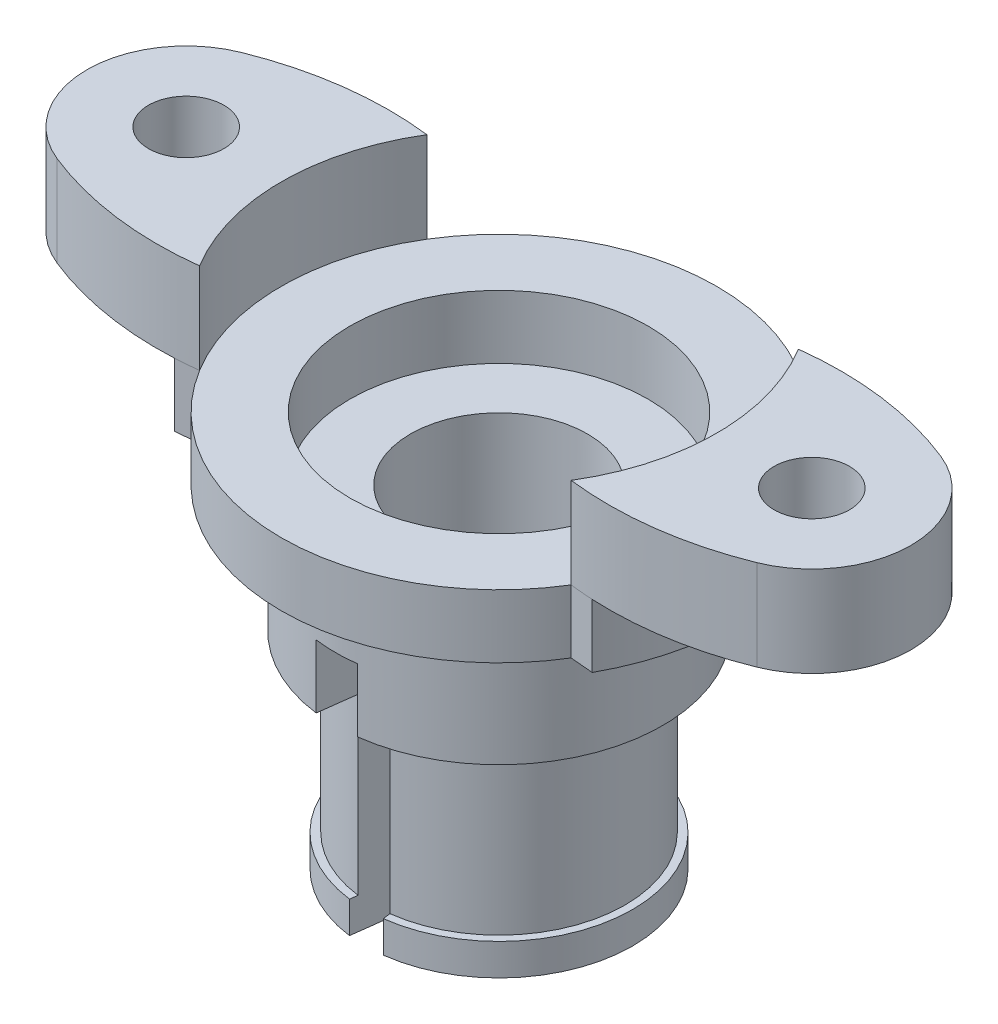
from build123d import *

# Parameters (mm, degrees)
SKETCH1_R             = 23.55
SKETCH1_R_2           = 14
BOSS_EXTRUDE4_DEPTH   = 10
SKETCH6_R             = 34.4
SKETCH6_R_2           = 23.55
BOSS_EXTRUDE5_DEPTH   = 10
SKETCH8_R             = 5.9563
BOSS_EXTRUDE7_DEPTH   = 14.3
BOSS_EXTRUDE7_2_DEPTH = 14.3
BOSS_EXTRUDE8_DEPTH   = 10
SKETCH10_R            = 25.832365573
SKETCH10_R_2          = 23.55
BOSS_EXTRUDE9_DEPTH   = 10
BOSS_EXTRUDE10_START  = 10
BOSS_EXTRUDE10_DEPTH  = 10
BOSS_EXTRUDE11_DEPTH  = 27.5
FILLET4_R             = 10
FILLET5_R             = 10
BOSS_EXTRUDE13_DEPTH  = 5


with BuildPart() as part:
    # Sketch1 → Boss-Extrude4 (new body)
    with BuildSketch(Plane(origin=(0, 0, 0), x_dir=(1, 0, 0), z_dir=(0, 1, 0))):
        with Locations(Location((0, 0, 0), (0, 0, 270))):
            Circle(SKETCH1_R)
        with Locations(Location((0, 0, 0), (0, 0, 270))):
            Circle(SKETCH1_R_2, mode=Mode.SUBTRACT)
    extrude(amount=BOSS_EXTRUDE4_DEPTH)



with BuildPart() as body_2:
    # Sketch6 → Boss-Extrude5 (new body)
    with BuildSketch(Plane(origin=(0, 10, 0), x_dir=(1, 0, 0), z_dir=(0, 1, 0))):
        with Locations(Location((0, 0, 0), (0, 0, 270))):
            Circle(SKETCH6_R)
        with Locations(Location((0, 0, 0), (0, 0, 270))):
            Circle(SKETCH6_R_2, mode=Mode.SUBTRACT)
    extrude(amount=BOSS_EXTRUDE5_DEPTH)



with BuildPart() as body_3:
    # Sketch8 → Boss-Extrude7 (new body)
    with BuildSketch(Plane(origin=(0, 20, 0), x_dir=(1, 0, 0), z_dir=(0, 1, 0))):
        with BuildLine():
            ThreePointArc((-55.268702708, 14.537801572), (-65.0875, 0), (-55.268702708, -14.537801572))
            ThreePointArc((-55.268702708, -14.537801572), (-42.522384328, -17.885755457), (-29.343880761, -17.952622702))
            ThreePointArc((-29.343880761, -17.952622702), (-34.4, 0), (-29.343880761, 17.952622702))
            ThreePointArc((-29.343880761, 17.952622702), (-42.522384328, 17.885755457), (-55.268702708, 14.537801572))
        make_face()
        with Locations(Location((-49.4157, 0, 0), (0, 0, 270))):
            Circle(SKETCH8_R, mode=Mode.SUBTRACT)
    extrude(amount=BOSS_EXTRUDE7_DEPTH)


with BuildPart() as body_4:
    # Sketch8 → Boss-Extrude7 2 (new body)
    with BuildSketch(Plane(origin=(0, 20, 0), x_dir=(1, 0, 0), z_dir=(0, 1, 0))):
        with BuildLine():
            ThreePointArc((55.268702708, 14.537801572), (42.522384328, 17.885755457), (29.343880761, 17.952622702))
            ThreePointArc((29.343880761, 17.952622702), (34.4, 0), (29.343880761, -17.952622702))
            ThreePointArc((29.343880761, -17.952622702), (42.522384328, -17.885755457), (55.268702708, -14.537801572))
            ThreePointArc((55.268702708, -14.537801572), (65.0875, 0), (55.268702708, 14.537801572))
        make_face()
        with Locations(Location((49.4157, 0, 0), (0, 0, 90))):
            Circle(SKETCH8_R, mode=Mode.SUBTRACT)
    extrude(amount=BOSS_EXTRUDE7_2_DEPTH)


with BuildPart() as body_2_1:
    add(body_2.part)

    add(body_3.part)  # Boss-Extrude8 merges body 3

    add(body_4.part)  # Boss-Extrude8 merges body 4
    # Sketch9 → Boss-Extrude8 (add)
    with BuildSketch(Plane.XZ.offset(-20)):
        with BuildLine():
            Line((-32.994341825, 18.26698083), (-29.343880761, 17.952622702))
            ThreePointArc((-29.343880761, 17.952622702), (-34.4, 0), (-29.343880761, -17.952622702))
            Line((-29.343880761, -17.952622702), (-32.994341825, -18.26698083))
            ThreePointArc((-32.994341825, -18.26698083), (-37.713514569, 0), (-32.994341825, 18.26698083))
        make_face()
        with BuildLine():
            Line((32.994341825, 18.26698083), (29.343880761, 17.952622702))
            ThreePointArc((29.343880761, 17.952622702), (34.4, 0), (29.343880761, -17.952622702))
            Line((29.343880761, -17.952622702), (32.994341825, -18.26698083))
            ThreePointArc((32.994341825, -18.26698083), (37.713514569, 0), (32.994341825, 18.26698083))
        make_face()
    extrude(amount=BOSS_EXTRUDE8_DEPTH)


with BuildPart() as part_1:
    add(part.part)

    add(body_2_1.part)  # Boss-Extrude9 merges body 2
    # Sketch10 → Boss-Extrude9 (add)
    with BuildSketch(Plane.XZ):
        with Locations(Location((0, 0, 0), (0, 0, 270))):
            Circle(SKETCH10_R)
        with Locations(Location((0, 0, 0), (0, 0, 90))):
            Circle(SKETCH10_R_2, mode=Mode.SUBTRACT)
    extrude(amount=-BOSS_EXTRUDE9_DEPTH)

    # Sketch11 → Boss-Extrude10 (add)
    with BuildSketch(Plane.XZ.offset(BOSS_EXTRUDE10_START)):
        with BuildLine():
            Line((-1.769995947, 13.887660507), (-3.265941597, 25.625080225))
            ThreePointArc((-3.265941597, 25.625080225), (-25.832365573, 0), (-3.265941597, -25.625080225))
            Line((-3.265941597, -25.625080225), (-1.769995947, -13.887660507))
            ThreePointArc((-1.769995947, -13.887660507), (-14, 0), (-1.769995947, 13.887660507))
        make_face()
        with BuildLine():
            Line((1.769995947, -13.887660507), (3.265941597, -25.625080225))
            ThreePointArc((3.265941597, -25.625080225), (25.832365573, 0), (3.265941597, 25.625080225))
            Line((3.265941597, 25.625080225), (1.769995947, 13.887660507))
            ThreePointArc((1.769995947, 13.887660507), (14, 0), (1.769995947, -13.887660507))
        make_face()
    extrude(amount=-BOSS_EXTRUDE10_DEPTH)

    # Sketch12 → Boss-Extrude11 (add)
    with BuildSketch(Plane.XZ.offset(10)):
        with BuildLine():
            Line((-1.769995947, 13.887660507), (-2.517968772, 19.756370366))
            ThreePointArc((-2.517968772, 19.756370366), (-19.916182786, 0), (-2.517968772, -19.756370366))
            Line((-2.517968772, -19.756370366), (-1.769995947, -13.887660507))
            Line((-1.769995947, -13.887660507), (-1.649889079, -12.945283544))
            ThreePointArc((-1.649889079, -12.945283544), (-13.05, 0), (-1.649889079, 12.945283544))
            Line((-1.649889079, 12.945283544), (-1.769995947, 13.887660507))
        make_face()
        with BuildLine():
            Line((1.769995947, 13.887660507), (2.517968772, 19.756370366))
            ThreePointArc((2.517968772, 19.756370366), (19.916182786, 0), (2.517968772, -19.756370366))
            Line((2.517968772, -19.756370366), (1.769995947, -13.887660507))
            Line((1.769995947, -13.887660507), (1.649889079, -12.945283544))
            ThreePointArc((1.649889079, -12.945283544), (13.05, 0), (1.649889079, 12.945283544))
            Line((1.649889079, 12.945283544), (1.769995947, 13.887660507))
        make_face()
    extrude(amount=BOSS_EXTRUDE11_DEPTH)

    # Fillet4
    # the kernel refuses this fillet: 10 mm, written as the material it takes off along each edge
    with BuildSketch(Plane(origin=(0, -10, 0), x_dir=(-0.12642828192325106, 0, -0.9919757504747456), z_dir=(0.9919757504747456, 0, -0.12642828192325106))) as fillet4_piece_1:
        with BuildLine():
            CenterArc((23.05, -4.254115654), FILLET4_R, 154.823283059, 25.176716941)
            Line((13.05, -4.254115654), (12.85, -4.254115654))
            Line((12.85, -4.254115654), (12.85, 0))
            Line((12.85, 0), (13.05, 0.2))
            ThreePointArc((13.05, 0.2), (13.525, 0.2), (13.819, 0.085082313))
            Line((13.819, 0.085082313), (14, 0))
        make_face()
    revolve(axis=Axis((0, -10, 0), (0, 1, 0)), revolution_arc=165.473510519, mode=Mode.SUBTRACT)

    # Fillet5
    # the kernel refuses this fillet: 10 mm, written as the material it takes off along each edge
    with BuildSketch(Plane(origin=(0, -10, 0), x_dir=(-0.6360006800114754, 0, -0.7716884961076852), z_dir=(-0.7716884961076852, 0, 0.6360006800114754))) as fillet5_piece_1:
        with BuildLine():
            CenterArc((23.05, 4.254115654), FILLET5_R, 180, 25.176716941)
            Line((13.05, 4.254115654), (12.85, 4.254115654))
            Line((12.85, 4.254115654), (12.85, 0))
            Line((12.85, 0), (13.05, -0.2))
            ThreePointArc((13.05, -0.2), (13.525, -0.2), (13.819, -0.085082313))
            Line((13.819, -0.085082313), (14, 0))
        make_face()
    revolve(axis=Axis((0, -10, 0), (0, -1, 0)), revolution_arc=258.988485214, mode=Mode.SUBTRACT)

    # Sketch14 → Boss-Extrude13 (add)
    with BuildSketch(Plane.XZ.offset(37.5)):
        with BuildLine():
            Line((-1.649889079, 12.945283544), (-2.670219685, 20.950954455))
            ThreePointArc((-2.670219685, 20.950954455), (-21.120430056, 0), (-2.670219685, -20.950954455))
            Line((-2.670219685, -20.950954455), (-1.649889079, -12.945283544))
            ThreePointArc((-1.649889079, -12.945283544), (-13.05, 0), (-1.649889079, 12.945283544))
        make_face()
        with BuildLine():
            Line((2.670219685, -20.950954455), (1.649889079, -12.945283544))
            ThreePointArc((1.649889079, -12.945283544), (13.05, 0), (1.649889079, 12.945283544))
            Line((1.649889079, 12.945283544), (2.670219685, 20.950954455))
            ThreePointArc((2.670219685, 20.950954455), (21.120430056, 0), (2.670219685, -20.950954455))
        make_face()
    extrude(amount=BOSS_EXTRUDE13_DEPTH)


solid = part_1.part
